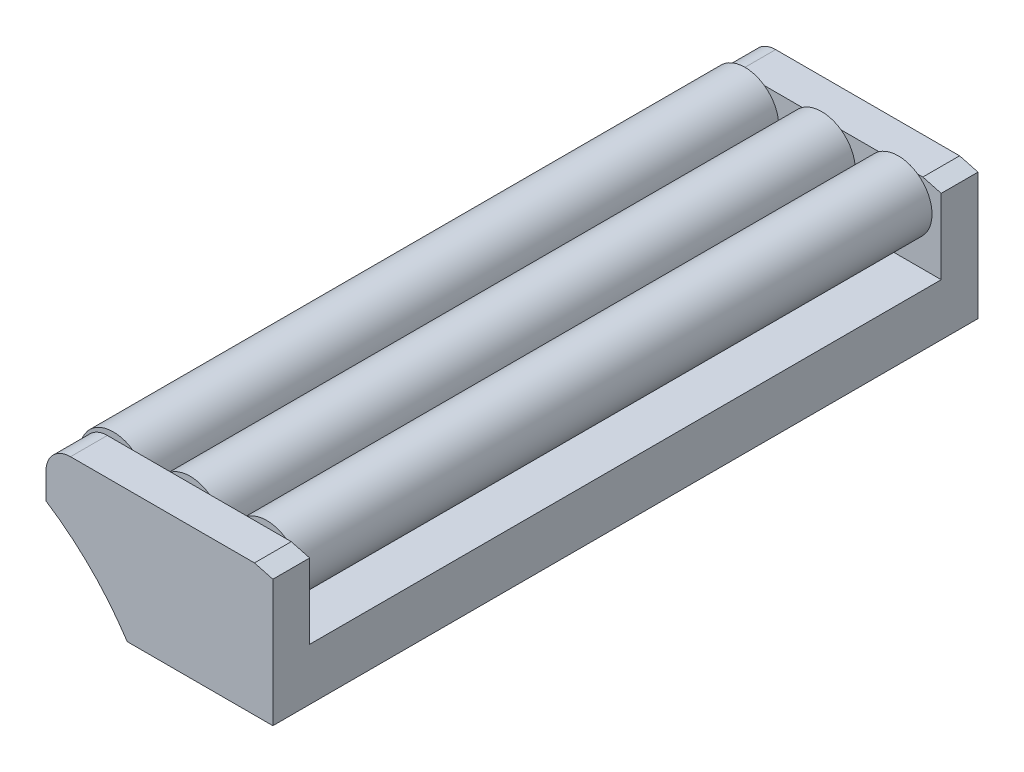
from build123d import *
from OCP.BRepFilletAPI import BRepFilletAPI_MakeChamfer

# Parameters (mm, degrees)
SCHIZZO1_W               = 37
SCHIZZO1_H               = 21.5
ESTRUSIONE1_DEPTH        = 115
SCHIZZO6_W               = 103
SCHIZZO6_H               = 23.639461627
TAGLIO_ESTRUSIONE4_DEPTH = 84
SCHIZZO7_R               = 5.5
ESTRUSIONE4_DEPTH        = 103
SMUSSO1_SIZE             = 3
SMUSSO1_SIZE2            = 0.803847577
RACCORDO1_R              = 4
SCHIZZO8_R               = 45
TAGLIO_ESTRUSIONE5_DEPTH = 123.883074506
SCHIZZO9_R               = 3
TAGLIO_ESTRUSIONE6_DEPTH = 8.5


with BuildPart() as part:
    # Schizzo1 → Estrusione1 (new body)
    with BuildSketch(Plane.XY):
        with Locations((18.5, 10.75)):
            Rectangle(SCHIZZO1_W, SCHIZZO1_H)
    extrude(amount=ESTRUSIONE1_DEPTH)

    # Schizzo6 → Taglio-Estrusione4 (cut)
    with BuildSketch(Plane(origin=(37, 0, 0), x_dir=(0, 0, -1), z_dir=(1, 0, 0))):
        with Locations((-57.5, 20.319730814)):
            Rectangle(SCHIZZO6_W, SCHIZZO6_H)
    extrude(amount=-TAGLIO_ESTRUSIONE4_DEPTH, mode=Mode.SUBTRACT)

    # Schizzo7 → Estrusione4 (add)
    with BuildSketch(Plane.XY.offset(6)):
        with Locations(Location((5, 17, 0), (0, 0, 155.380022671))):
            Circle(SCHIZZO7_R)
        with Locations(Location((17.5, 17, 0), (0, 0, 125.096801228))):
            Circle(SCHIZZO7_R)
        with Locations(Location((30, 17, 0), (0, 0, 125.096801228))):
            Circle(SCHIZZO7_R)
    extrude(amount=ESTRUSIONE4_DEPTH)

    # Smusso1: one chamfer whose edges measure the first distance from different faces: ONE call of the kernel's chamfer builder (chamfer() names one face for all edges)
    smusso1_edges_1 = [part.edges().sort_by_distance(p)[0] for p in [
        (37, 21.5, 3),
    ]]
    smusso1_side_1 = [part.faces().sort_by_distance(p)[0] for p in [
        (18.5, 21.5, 3),
    ]]
    smusso1_edges_2 = [part.edges().sort_by_distance(p)[0] for p in [
        (37, 21.5, 112),
    ]]
    smusso1_side_2 = [part.faces().sort_by_distance(p)[0] for p in [
        (18.5, 21.5, 112),
    ]]
    smusso1 = BRepFilletAPI_MakeChamfer(part.part.solid().wrapped)
    for e in smusso1_edges_1:
        smusso1.Add(SMUSSO1_SIZE, SMUSSO1_SIZE2, e.wrapped, smusso1_side_1[0].wrapped)  # the first distance lies on this face
    for e in smusso1_edges_2:
        smusso1.Add(SMUSSO1_SIZE, SMUSSO1_SIZE2, e.wrapped, smusso1_side_2[0].wrapped)  # the first distance lies on this face
    add(Compound.cast(smusso1.Shape()), mode=Mode.REPLACE)

    # Raccordo1
    # the kernel refuses this fillet: 4 mm, written as the material it takes off along each edge
    with BuildSketch(Plane(origin=(0, 21.5, -10), x_dir=(1, 0, 0), z_dir=(0, 0, 1))) as raccordo1_piece_1:
        with BuildLine():
            CenterArc((RACCORDO1_R, -RACCORDO1_R), RACCORDO1_R, 90, 90)
            Line((0, -RACCORDO1_R), (0, 0))
            Line((0, 0), (RACCORDO1_R, 0))
        make_face()
    extrude(amount=16, mode=Mode.SUBTRACT)
    with BuildSketch(Plane(origin=(0, 21.5, 109), x_dir=(0, -1, 0), z_dir=(0, 0, 1))) as raccordo1_piece_2:
        with BuildLine():
            CenterArc((RACCORDO1_R, RACCORDO1_R), RACCORDO1_R, 180, 90)
            Line((0, RACCORDO1_R), (0, 0))
            Line((0, 0), (RACCORDO1_R, 0))
        make_face()
    extrude(amount=16, mode=Mode.SUBTRACT)

    # Schizzo8 → Taglio-Estrusione5 (cut, through all)
    with BuildSketch(Plane.XY.offset(115)):
        with Locations((-24.5, -24.5)):
            Circle(SCHIZZO8_R)
    extrude(amount=-TAGLIO_ESTRUSIONE5_DEPTH, mode=Mode.SUBTRACT)

    # Schizzo9 → Taglio-Estrusione6 (cut)
    with BuildSketch(Plane.XZ):
        with Locations(Location((23, 105.5, 0), (0, 0, 270))):
            Circle(SCHIZZO9_R)
        with Locations(Location((23, 9.5, 0), (0, 0, 270))):
            Circle(SCHIZZO9_R)
    extrude(amount=-TAGLIO_ESTRUSIONE6_DEPTH, mode=Mode.SUBTRACT)


solid = part.part
